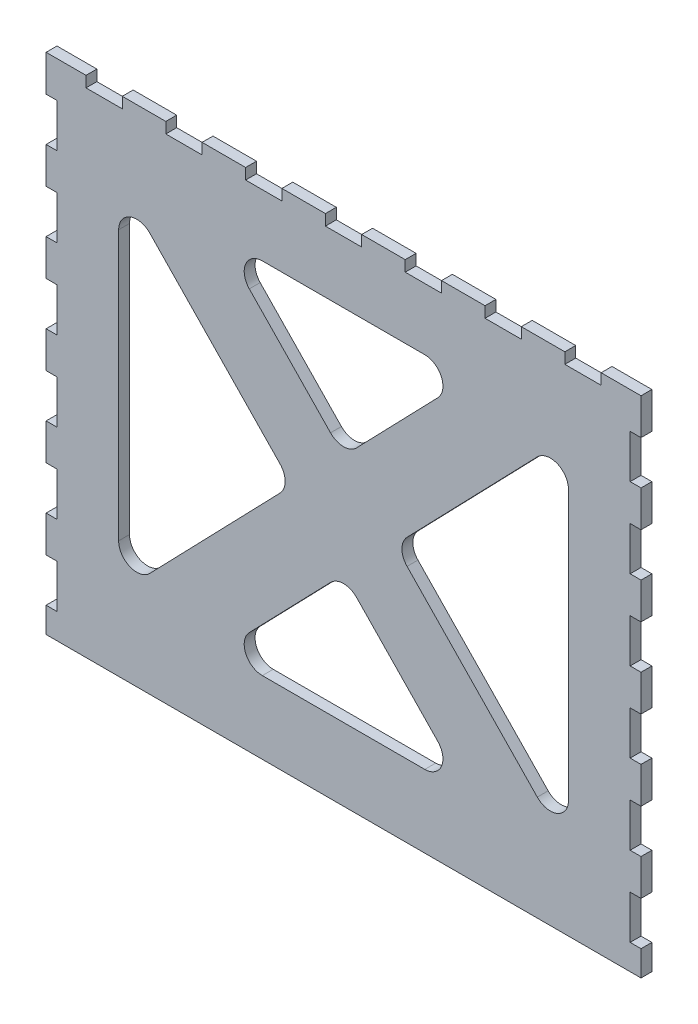
from build123d import *

# Parameters (mm, degrees)
SKETCH1_W           = 164
SKETCH1_H           = 139
BOSS_EXTRUDE1_DEPTH = 3
SKETCH2_W           = 10
SKETCH2_H           = 3
SKETCH2_W_2         = 3
SKETCH2_H_2         = 12
CUT_EXTRUDE1_DEPTH  = 10


with BuildPart() as part:
    # Sketch1 → Boss-Extrude1 (new body)
    with BuildSketch(Plane.XY.offset(152)):
        Rectangle(SKETCH1_W, SKETCH1_H)
        with BuildLine():
            Line((-62, -37.134656801), (-62, 37.134656801))
            ThreePointArc((-62, 37.134656801), (-58.87434678, 41.770045043), (-53.405270341, 40.609986811))
            Line((-53.405270341, 40.609986811), (-17.504048439, 3.47533001))
            ThreePointArc((-17.504048439, 3.47533001), (-16.098778099, 0), (-17.504048439, -3.47533001))
            Line((-17.504048439, -3.47533001), (-53.405270341, -40.609986811))
            ThreePointArc((-53.405270341, -40.609986811), (-58.87434678, -41.770045043), (-62, -37.134656801))
        make_face(mode=Mode.SUBTRACT)
        with BuildLine():
            Line((22.39294647, 49.5), (-22.39294647, 49.5))
            ThreePointArc((-22.39294647, 49.5), (-26.996024247, 46.452351141), (-25.987676129, 41.02466999))
            Line((-25.987676129, 41.02466999), (-3.594729659, 17.862383642))
            ThreePointArc((-3.594729659, 17.862383642), (0, 16.337713652), (3.594729659, 17.862383642))
            Line((3.594729659, 17.862383642), (25.987676129, 41.02466999))
            ThreePointArc((25.987676129, 41.02466999), (26.996024247, 46.452351141), (22.39294647, 49.5))
        make_face(mode=Mode.SUBTRACT)
        with BuildLine():
            Line((53.405270341, 40.609986811), (17.504048439, 3.47533001))
            ThreePointArc((17.504048439, 3.47533001), (16.098778099, 0), (17.504048439, -3.47533001))
            Line((17.504048439, -3.47533001), (53.405270341, -40.609986811))
            ThreePointArc((53.405270341, -40.609986811), (58.87434678, -41.770045043), (62, -37.134656801))
            Line((62, -37.134656801), (62, 37.134656801))
            ThreePointArc((62, 37.134656801), (58.87434678, 41.770045043), (53.405270341, 40.609986811))
        make_face(mode=Mode.SUBTRACT)
        with BuildLine():
            Line((-25.987676129, -41.02466999), (-3.594729659, -17.862383642))
            ThreePointArc((-3.594729659, -17.862383642), (0, -16.337713652), (3.594729659, -17.862383642))
            Line((3.594729659, -17.862383642), (25.987676129, -41.02466999))
            ThreePointArc((25.987676129, -41.02466999), (26.996024247, -46.452351141), (22.39294647, -49.5))
            Line((22.39294647, -49.5), (-22.39294647, -49.5))
            ThreePointArc((-22.39294647, -49.5), (-26.996024247, -46.452351141), (-25.987676129, -41.02466999))
        make_face(mode=Mode.SUBTRACT)
    extrude(amount=BOSS_EXTRUDE1_DEPTH)

    # Sketch2 → Cut-Extrude1 (cut)
    with BuildSketch(Plane.XY.offset(155)):
        with Locations((0, 68)):
            Rectangle(SKETCH2_W, SKETCH2_H)
        with Locations((-22, 68)):
            Rectangle(SKETCH2_W, SKETCH2_H)
        with Locations((22, 68)):
            Rectangle(SKETCH2_W, SKETCH2_H)
        with Locations((-80.5, -56.5)):
            Rectangle(SKETCH2_W_2, SKETCH2_H_2)
        with Locations((80.5, -56.5)):
            Rectangle(SKETCH2_W_2, SKETCH2_H_2)
        with Locations((-44, 68)):
            Rectangle(SKETCH2_W, SKETCH2_H)
        with Locations((44, 68)):
            Rectangle(SKETCH2_W, SKETCH2_H)
        with Locations((-80.5, -34.5)):
            Rectangle(SKETCH2_W_2, SKETCH2_H_2)
        with Locations((80.5, -34.5)):
            Rectangle(SKETCH2_W_2, SKETCH2_H_2)
        with Locations((-66, 68)):
            Rectangle(SKETCH2_W, SKETCH2_H)
        with Locations((66, 68)):
            Rectangle(SKETCH2_W, SKETCH2_H)
        with Locations((-80.5, -12.5)):
            Rectangle(SKETCH2_W_2, SKETCH2_H_2)
        with Locations((80.5, -12.5)):
            Rectangle(SKETCH2_W_2, SKETCH2_H_2)
        with Locations((-80.5, 53.5)):
            Rectangle(SKETCH2_W_2, SKETCH2_H_2)
        with Locations((80.5, 53.5)):
            Rectangle(SKETCH2_W_2, SKETCH2_H_2)
        with Locations((-80.5, 9.5)):
            Rectangle(SKETCH2_W_2, SKETCH2_H_2)
        with Locations((80.5, 9.5)):
            Rectangle(SKETCH2_W_2, SKETCH2_H_2)
        with Locations((-80.5, 31.5)):
            Rectangle(SKETCH2_W_2, SKETCH2_H_2)
        with Locations((80.5, 31.5)):
            Rectangle(SKETCH2_W_2, SKETCH2_H_2)
    extrude(amount=-CUT_EXTRUDE1_DEPTH, mode=Mode.SUBTRACT)


solid = part.part
